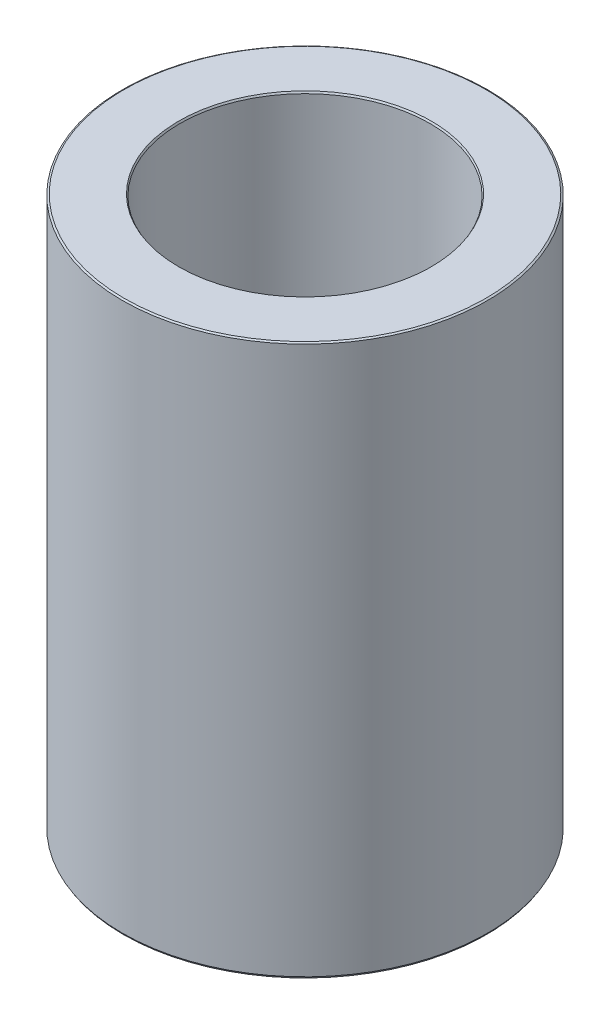
from build123d import *
from OCP.BRepFilletAPI import BRepFilletAPI_MakeChamfer

# Parameters (mm, degrees)
SKETCH1_R           = 50
BOSS_EXTRUDE1_DEPTH = 150.780022602
SKETCH2_R           = 34.298430562
CUT_EXTRUDE1_DEPTH  = 167.53712864
CHAMFER1_SIZE       = 0.275455341
CHAMFER1_SIZE2      = 0.477102647


with BuildPart() as part:
    # Sketch1 → Boss-Extrude1 (new body)
    with BuildSketch(Plane(origin=(0, 0, 0), x_dir=(1, 0, 0), z_dir=(0, 1, 0))):
        Circle(SKETCH1_R)
    extrude(amount=BOSS_EXTRUDE1_DEPTH)

    # Sketch2 → Cut-Extrude1 (cut, through all)
    with BuildSketch(Plane(origin=(0, 0, 0), x_dir=(1, 0, 0), z_dir=(0, 1, 0))):
        Circle(SKETCH2_R)
    extrude(amount=CUT_EXTRUDE1_DEPTH, mode=Mode.SUBTRACT)

    # Chamfer1: one chamfer whose edges measure the first distance from different faces: ONE call of the kernel's chamfer builder (chamfer() names one face for all edges)
    chamfer1_edges_1 = [part.edges().sort_by_distance(p)[0] for p in [
        (-34.298430562, 150.780022602, 0),
    ]]
    chamfer1_side_1 = [part.faces().sort_by_distance(p)[0] for p in [
        (-48.585786438, 150.780022602, 0),
    ]]
    chamfer1_edges_2 = [part.edges().sort_by_distance(p)[0] for p in [
        (-34.298430562, 0, 0),
    ]]
    chamfer1_side_2 = [part.faces().sort_by_distance(p)[0] for p in [
        (-34.298430562, 75.390011301, 0),
    ]]
    chamfer1_edges_3 = [part.edges().sort_by_distance(p)[0] for p in [
        (-50, 0, 0),
    ]]
    chamfer1_side_3 = [part.faces().sort_by_distance(p)[0] for p in [
        (-48.585786438, 0, 0),
    ]]
    chamfer1_edges_4 = [part.edges().sort_by_distance(p)[0] for p in [
        (-50, 150.780022602, 0),
    ]]
    chamfer1_side_4 = [part.faces().sort_by_distance(p)[0] for p in [
        (-50, 75.390011301, 0),
    ]]
    chamfer1 = BRepFilletAPI_MakeChamfer(part.part.solid().wrapped)
    for e in chamfer1_edges_1:
        chamfer1.Add(CHAMFER1_SIZE, CHAMFER1_SIZE2, e.wrapped, chamfer1_side_1[0].wrapped)  # the first distance lies on this face
    for e in chamfer1_edges_2:
        chamfer1.Add(CHAMFER1_SIZE, CHAMFER1_SIZE2, e.wrapped, chamfer1_side_2[0].wrapped)  # the first distance lies on this face
    for e in chamfer1_edges_3:
        chamfer1.Add(CHAMFER1_SIZE, CHAMFER1_SIZE2, e.wrapped, chamfer1_side_3[0].wrapped)  # the first distance lies on this face
    for e in chamfer1_edges_4:
        chamfer1.Add(CHAMFER1_SIZE, CHAMFER1_SIZE2, e.wrapped, chamfer1_side_4[0].wrapped)  # the first distance lies on this face
    add(Compound.cast(chamfer1.Shape()), mode=Mode.REPLACE)


solid = part.part
